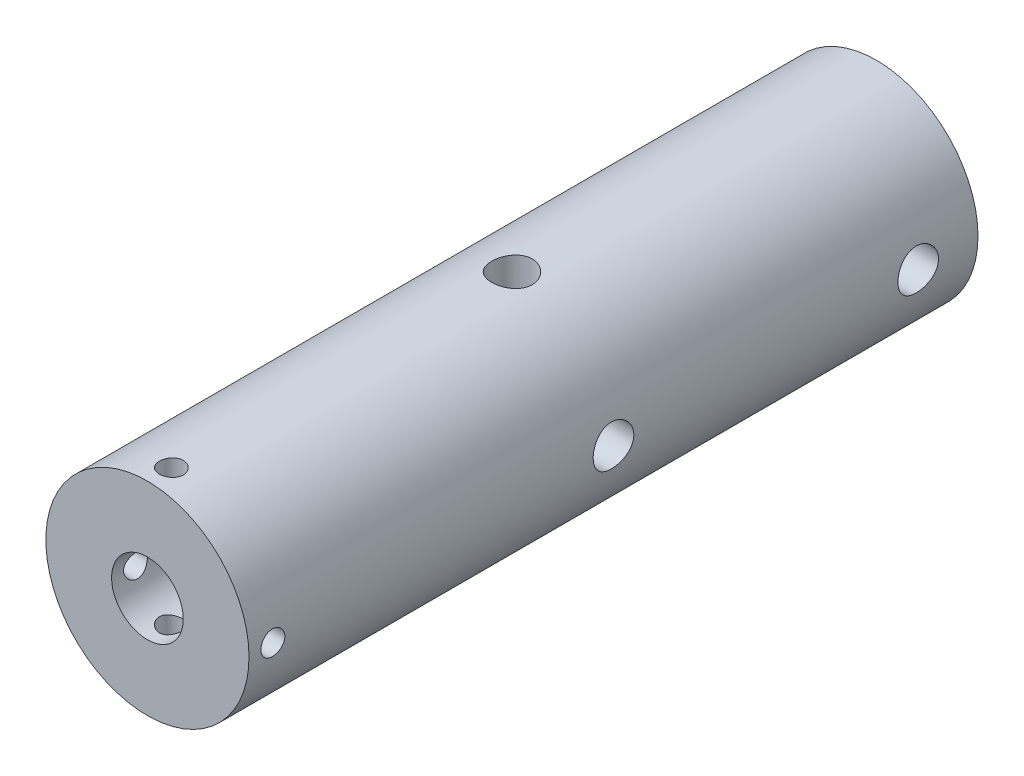
from build123d import *

# Parameters (mm, degrees)
SKETCH1_R               = 8.5
BOSS_EXTRUDE1_DEPTH     = 61
SKETCH9_R               = 1.7
CUT_EXTRUDE2_DEPTH      = 6.7
SKETCH10_R              = 1
CUT_EXTRUDE3_DEPTH      = 8.7
CIRPATTERN1_COUNT       = 4
SKETCH11_R              = 1.7
CUT_EXTRUDE4_DEPTH      = 26.7
CUT_EXTRUDE5_DEPTH      = 10
CUT_EXTRUDE5_DEPTH_BACK = 10
SKETCH12_R              = 1.7


with BuildPart() as part:
    # Sketch1 → Boss-Extrude1 (new body)
    with BuildSketch(Plane.XY):
        Circle(SKETCH1_R)
    extrude(amount=BOSS_EXTRUDE1_DEPTH)

    # Sketch7 → Cut-Revolve1 (revolve, cut)
    with BuildSketch(Plane(origin=(0, 0, 0), x_dir=(0, 0, -1), z_dir=(1, 0, 0))):
        Polygon((-61, 3), (-5, 3), (-1, 1.5), (0, 1.5), (0, 0), (-61, 0), align=None)
    revolve(axis=Axis((0, 0, 0), (0, 0, 1)), mode=Mode.SUBTRACT)

    # Sketch9 → Cut-Extrude2 (cut)
    with BuildSketch(Plane(origin=(8.5, 0, 0), x_dir=(0, 0, -1), z_dir=(1, 0, 0))):
        with Locations((-5, 0)):
            Circle(SKETCH9_R)
    extrude(amount=-CUT_EXTRUDE2_DEPTH, mode=Mode.SUBTRACT)

    # Sketch10 → Cut-Extrude3 (cut)
    with BuildSketch(Plane(origin=(0, 0, 0), x_dir=(0, 0, -1), z_dir=(1, 0, 0))):
        with Locations((-59, 0)):
            Circle(SKETCH10_R)
    cut_extrude3 = extrude(amount=-CUT_EXTRUDE3_DEPTH, mode=Mode.SUBTRACT)

    # CirPattern1: Cut-Extrude3 ×4 about axis
    cirpattern1_axis = Axis((0, 0, 61), (0, 0, 1))
    for i in range(1, CIRPATTERN1_COUNT):
        add(cut_extrude3.rotate(cirpattern1_axis, i * 360 / CIRPATTERN1_COUNT), mode=Mode.SUBTRACT)

    # Sketch11 → Cut-Extrude4 (cut)
    with BuildSketch(Plane(origin=(0, 8.5, 0), x_dir=(1, 0, 0), z_dir=(0, 1, 0))):
        with Locations((0, -30.5)):
            Circle(SKETCH11_R)
    extrude(amount=-CUT_EXTRUDE4_DEPTH, mode=Mode.SUBTRACT)

    # Sketch12 → Cut-Extrude5 (cut, two sides: drawn at the far end of the back side and taken through both)
    with BuildSketch(Plane(origin=(0, 0, 0), x_dir=(0, 0, -1), z_dir=(1, 0, 0)).offset(-CUT_EXTRUDE5_DEPTH_BACK)):
        with Locations((-30.5, 0)):
            Circle(SKETCH12_R)
    extrude(amount=CUT_EXTRUDE5_DEPTH + CUT_EXTRUDE5_DEPTH_BACK, mode=Mode.SUBTRACT)


solid = part.part
